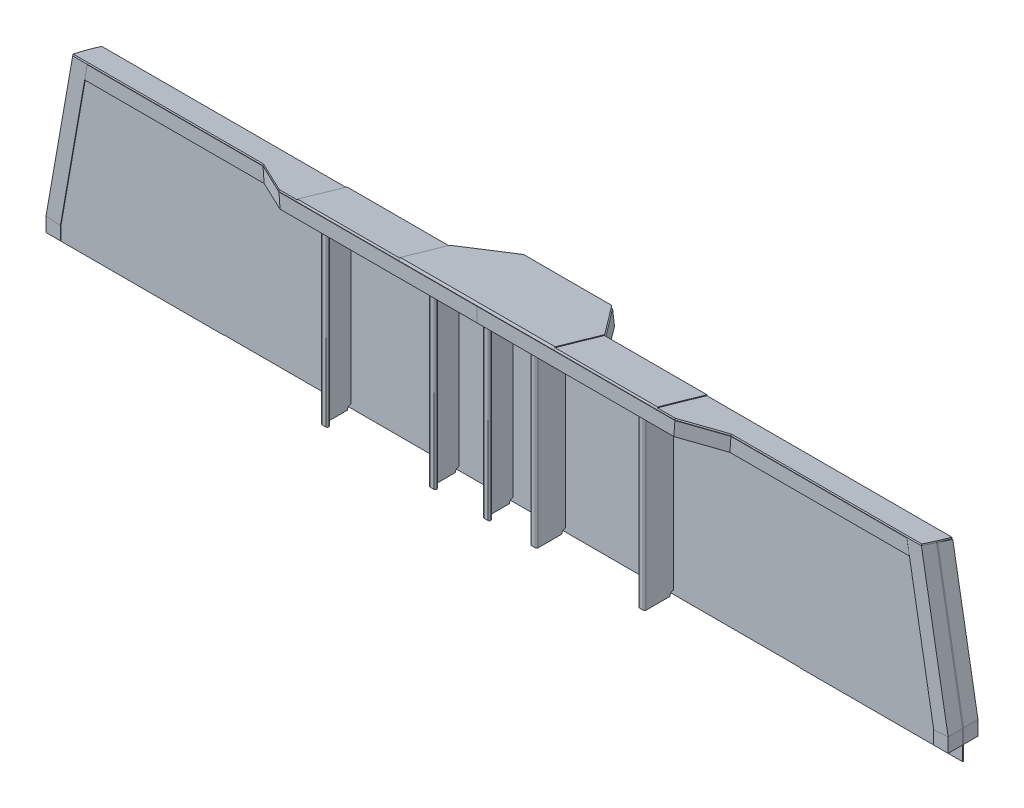
from build123d import *

# Parameters (mm, degrees)
EXTRUDE_1_DEPTH              = 3
EXTRUDE_2_DEPTH              = 8
EXTRUDE_3_DEPTH              = 6
SKETCH_7_W                   = 143.0000000000009
SKETCH_7_H                   = 680.999999999952
EXTRUDE_4_DEPTH              = 4
CUT_EXTRUDE_1_DEPTH          = 3887.794310978597
SWEEP_START                  = -3830
SWEEP_1_DEPTH                = 38
SWEEP_START_2                = -3793
SWEEP_1_2_DEPTH              = 1
SWEEP_START_3                = -921.503739553
SWEEP_1_3_DEPTH              = 416.27394826
SWEEP_START_4                = -505.316929463
SWEEP_1_4_DEPTH              = 3.846932143
SWEEP_START_5                = 693
SWEEP_1_5_DEPTH              = 40
EXTRUDE_5_REACH              = 4241.638
CUT_EXTRUDE_2_DEPTH          = 3887.350957917266
EXTRUDE_6_REACH              = 4215.277
PATTERN_LINEAR_1_COUNT       = 2
PATTERN_LINEAR_1_PITCH       = 150
PATTERN_LINEAR_2_COUNT       = 2
PATTERN_LINEAR_2_PITCH       = 450
EXTRUDE_7_DEPTH              = 4
EXTRUDE_8_REACH              = 4215.402
SKETCH_18_W                  = 20
SKETCH_18_H                  = 1
SKETCH_18_W_2                = 16.999999999999773
SKETCH_18_H_2                = 3.8854169092151096
CUT_EXTRUDE_3_DEPTH          = 1726.334637879581
CUT_EXTRUDE_4_DEPTH          = 4
EXTRUDE_9_DEPTH              = 3
CUT_EXTRUDE_5_DEPTH          = 3
EXTRUDE_10_DEPTH             = 3
FILLET_1_R                   = 8
FILLET_2_R                   = 11
PATTERN_LINEAR_3_COUNT       = 2
PATTERN_LINEAR_3_PITCH       = 150
CUT_EXTRUDE_6_DEPTH          = 4390.143704412877
PATTERN_START                = -3865
PATTERN_LINEAR_5_DEPTH       = 4
PATTERN_START_2              = 654
PATTERN_LINEAR_5_2_DEPTH     = 488.713254614
PATTERN_LINEAR_5_3_DEPTH     = 489
PATTERN_START_3              = 2155.791378016
PATTERN_LINEAR_5_4_OUTLINE_W = 6
PATTERN_LINEAR_5_4_OUTLINE_H = 34
PATTERN_LINEAR_5_4_DEPTH     = 9.208621984
CUT_EXTRUDE_7_DEPTH          = 4390.143704412877
SWEEP_START_6                = -3875
SWEEP_3_DEPTH                = 38
SWEEP_3_2_DEPTH              = 1
SWEEP_3_3_DEPTH              = 416.27394826
SWEEP_3_4_DEPTH              = 3.846932143
SWEEP_3_5_DEPTH              = 40
CUT_EXTRUDE_9_DEPTH          = 17
CUT_EXTRUDE_9_DEPTH_BACK     = 2563.0947984233594
SKETCH_34_W                  = 3.0000000000004547
SKETCH_34_H                  = 40
EXTRUDE_11_DEPTH             = 3
CUT_EXTRUDE_10_DEPTH         = 4345.251787695612
CUT_EXTRUDE_10_DEPTH_BACK    = 4345.251787695612
CUT_EXTRUDE_START            = -2001
CUT_EXTRUDE_11_DEPTH         = 5
CUT_EXTRUDE_START_2          = -4
CUT_EXTRUDE_11_2_DEPTH       = 5
CUT_EXTRUDE_START_3          = -1501
CUT_EXTRUDE_12_DEPTH         = 5
CUT_EXTRUDE_START_4          = -1201
CUT_EXTRUDE_12_2_DEPTH       = 5
CUT_EXTRUDE_START_5          = -304
CUT_EXTRUDE_12_3_DEPTH       = 5
CUT_EXTRUDE_12_4_DEPTH       = 5


with BuildPart() as part:
    # Эскиз3 → Бобышка-Вытянуть1 (new body)
    with BuildSketch(Plane.XY.offset(-3834.9999999999995)):
        Polygon((1253, 653), (1253, 733), (1181, 1143), (-1181, 1143), (-1253, 733), (-1253, 653), (-800, 653), (-800, 654.0000000000001), (800, 654.0000000000001), (800, 653), align=None)
    extrude(amount=EXTRUDE_1_DEPTH)


with BuildPart() as body_2:
    # Эскиз5 → Бобышка-Вытянуть2 (new body)
    with BuildSketch(Plane(origin=(0, 2072.279676120572, -594.2166351293336), x_dir=(0, -0.2756373558170004, -0.9612616959383186), z_dir=(0, -0.9612616959383186, 0.2756373558170004))):
        Polygon((3411.501321136804, -215.00000000000009), (3268.501321136804, -215.00000000000003), (3268.501321136804, 215.00000000000003), (3411.501321136804, 215.00000000000009), (3528.501321136804, 122.5), (3528.501321136804, -122.5), align=None)
    extrude(amount=-EXTRUDE_2_DEPTH)


with BuildPart() as body_3:
    # Эскиз6 → Бобышка-Вытянуть3 (new body)
    with BuildSketch(Plane(origin=(0, 2072.279676120572, -594.2166351293336), x_dir=(0, -0.2756373558170004, -0.9612616959383186), z_dir=(0, -0.9612616959383186, 0.2756373558170004))):
        Polygon((3268.5013211368023, 215.00000000000003), (3411.5013211368027, 215.00000000000009), (3411.501321136803, 500.000000000048), (3268.5013211368023, 500.000000000048), align=None)
    extrude(amount=-EXTRUDE_3_DEPTH)


with BuildPart() as body_4:
    # Эскиз7 → Бобышка-Вытянуть4 (new body)
    with BuildSketch(Plane(origin=(0, 2072.279676120572, -594.2166351293336), x_dir=(0, -0.2756373558170004, -0.9612616959383186), z_dir=(0, -0.9612616959383186, 0.2756373558170004))):
        with Locations((3340.001321136801, 840.500000000024)):
            Rectangle(SKETCH_7_W, SKETCH_7_H)
    extrude(amount=-EXTRUDE_4_DEPTH)

    # Эскиз10 → Вырез-Вытянуть1 (cut, through all)
    with BuildSketch(Plane(origin=(0, 2076.1247229043233, -595.3191845525989), x_dir=(1, 0, 0), z_dir=(0, 0.9612616959383188, -0.2756373558169998))):
        Polygon((550.000000000048, 3268.501321136802), (650.000000000048, 3326.501321136804), (1181, 3326.501321136804), (1181, 3268.501321136802), align=None)
    extrude(amount=-CUT_EXTRUDE_1_DEPTH, mode=Mode.SUBTRACT)


with BuildPart() as body_5:
    # По траектории1: read off the stored shape, not the designer's step
    # По траектории1 outline → По траектории1 (new body)
    with BuildSketch(Plane.XY.offset(SWEEP_START)):
        Polygon((1181, 1143), (1178.045215044, 1142.481110935), (1250, 732.738585489), (1250, 693), (1253, 693), (1253, 733), align=None)
    extrude(amount=SWEEP_1_DEPTH)

    # Sweep 1 2 outline → Sweep 1 2 (add)
    with BuildSketch(Plane.XY.offset(SWEEP_START_2)):
        Polygon((1141.60286725, 1136.081479127), (1213, 729.514473189), (1213, 693), (1250, 693), (1250, 732.738585489), (1178.045215044, 1142.481110935), align=None)
    extrude(amount=SWEEP_1_2_DEPTH)

    # Sweep 1 3 outline → Sweep 1 3 (add)
    with BuildSketch(Plane(origin=(0, 0, 0), x_dir=(0.9849283187519632, 0.17296302182961304, 0), z_dir=(0.17296302182961304, -0.9849283187519632, 0)).offset(SWEEP_START_3)):
        with BuildLine():
            Line((1360.897078397, -3830), (1357.897078397, -3830))
            ThreePointArc((1357.897078397, -3830), (1358.482864835, -3831.414213562), (1359.897078397, -3832))
            Line((1359.897078397, -3832), (1360.897078397, -3832))
            Line((1360.897078397, -3832), (1360.897078397, -3830))
        make_face()
        with BuildLine():
            ThreePointArc((1320.897078397, -3793), (1321.482864835, -3794.414213562), (1322.897078397, -3795))
            Line((1322.897078397, -3795), (1354.897078397, -3795))
            ThreePointArc((1354.897078397, -3795), (1357.018398741, -3795.878679656), (1357.897078397, -3798))
            Line((1357.897078397, -3798), (1357.897078398, -3793))
            Line((1357.897078398, -3793), (1320.897078397, -3793))
        make_face()
    extrude(amount=SWEEP_1_3_DEPTH)

    # Sweep 1 4 outline → Sweep 1 4 (add)
    with BuildSketch(Plane(origin=(0, 0, 0), x_dir=(0.9849283187519632, 0.17296302182961304, 0), z_dir=(0.17296302182961304, -0.9849283187519632, 0)).offset(SWEEP_START_4)):
        with BuildLine():
            ThreePointArc((1320.897078397, -3793), (1321.482864835, -3794.414213562), (1322.897078397, -3795))
            Line((1322.897078397, -3795), (1354.897078397, -3795))
            ThreePointArc((1354.897078397, -3795), (1357.018398741, -3795.878679656), (1357.897078397, -3798))
            Line((1357.897078397, -3798), (1357.897078398, -3793))
            Line((1357.897078398, -3793), (1320.897078397, -3793))
        make_face()
    extrude(amount=SWEEP_1_4_DEPTH)

    # Sweep 1 5 outline → Sweep 1 5 (add)
    with BuildSketch(Plane(origin=(0, 0, 0), x_dir=(1, 0, 0), z_dir=(0, 1, 0)).offset(SWEEP_START_5)):
        with BuildLine():
            ThreePointArc((1250, 3798), (1249.121320344, 3795.878679656), (1247, 3795))
            Line((1247, 3795), (1215, 3795))
            ThreePointArc((1215, 3795), (1213.585786438, 3794.414213562), (1213, 3793))
            Line((1213, 3793), (1250, 3793))
            Line((1250, 3793), (1250, 3798))
        make_face()
        with BuildLine():
            ThreePointArc((1252, 3832), (1250.585786438, 3831.414213562), (1250, 3830))
            Line((1250, 3830), (1253, 3830))
            Line((1253, 3830), (1253, 3832))
            Line((1253, 3832), (1252, 3832))
        make_face()
    extrude(amount=SWEEP_1_5_DEPTH)


    # Бобышка-Вытянуть5: up to this face of the body (flat: up to its plane)
    extrude_5_end = Plane(body_4.part.faces().sort_by_distance((814.422692418, 1145.330606227, -3826.87221018))[0])
    # Эскиз12 → Бобышка-Вытянуть5 (add, up to the picked face)
    with BuildSketch(Plane(origin=(-159.38607142032706, 907.6151289213092, 0), x_dir=(0.9849283187519633, 0.17296302182961268, 0), z_dir=(-0.17296302182961268, 0.9849283187519633, 0)), mode=Mode.PRIVATE) as extrude_5_sk1:
        with BuildLine():
            Line((1320.8970783973152, 3792.999999999999), (1320.8970783973152, 3791.9999999999995))
            Line((1320.8970783973152, 3791.9999999999995), (1360.8970783973157, 3791.9999999999995))
            Line((1360.8970783973157, 3791.9999999999995), (1360.8970783973155, 3831.9999999999995))
            Line((1360.8970783973155, 3831.9999999999995), (1359.8970783973155, 3831.9999999999995))
            ThreePointArc((1359.8970783973155, 3831.9999999999995), (1358.4828648349421, 3831.4142135623724), (1357.8970783973152, 3829.999999999999))
            Line((1357.8970783973152, 3829.999999999999), (1357.8970783973157, 3797.999999999999))
            ThreePointArc((1357.8970783973157, 3797.999999999999), (1357.018398740875, 3795.8786796564395), (1354.8970783973155, 3794.999999999999))
            Line((1354.8970783973155, 3794.999999999999), (1322.8970783973155, 3794.9999999999995))
            ThreePointArc((1322.8970783973155, 3794.9999999999995), (1321.4828648349421, 3794.4142135623724), (1320.8970783973152, 3792.999999999999))
        make_face()
    extrude_5_tool1 = split(extrude(extrude_5_sk1.sketch, amount=EXTRUDE_5_REACH, mode=Mode.PRIVATE), bisect_by=extrude_5_end, keep=Keep.BOTH, mode=Mode.PRIVATE)
    add(extrude_5_tool1.solids().sort_by(Axis((1142.160027, 1136.179322, -3792.5), (-0.17296302182961268, 0.9849283187519633, 0)))[0])


with BuildPart() as body_4_1:
    add(body_4.part)

    # Эскиз13 → Вырез-Вытянуть2 (cut, through all)
    with BuildSketch(Plane(origin=(0, 2072.27967612057, -594.2166351293309), x_dir=(1, 0, 0), z_dir=(0, -0.9612616959383187, 0.27563735581699983))):
        Polygon((1178.8274179401756, -3326.501321136804), (1181, -3371.3851062246213), (1181, -3326.501321136804), align=None)
    extrude(amount=-CUT_EXTRUDE_2_DEPTH, mode=Mode.SUBTRACT)


with BuildPart() as body_6:
    # Бобышка-Вытянуть6: up to this plane
    extrude_6_end = Plane(origin=(0, 2072.2796761205745, -594.216635129336), z_dir=(0, -0.9612616959383185, 0.2756373558170011))
    # Эскиз14 → Бобышка-Вытянуть6 (new, up to the surface)
    with BuildSketch(Plane.XZ.offset(-654.0000000000001), mode=Mode.PRIVATE) as extrude_6_sk1:
        with BuildLine():
            Line((-6.6613e-13, -3831.9999999999995), (-1.22125e-12, -3755.9999999999995))
            ThreePointArc((-1.22125e-12, -3755.9999999999995), (1.1715728752524424, -3753.1715728752533), (3.9999999999985603, -3751.9999999999995))
            Line((3.9999999999985603, -3751.9999999999995), (14.289016615090855, -3751.999999999999))
            ThreePointArc((14.289016615090855, -3751.999999999999), (18.091689930528247, -3754.7591633241786), (16.64826487307003, -3759.2301621719685))
            Line((16.64826487307003, -3759.2301621719685), (5.640751742019723, -3767.2698378280297))
            ThreePointArc((5.640751742019723, -3767.2698378280297), (4.433699884198441, -3768.688507939834), (3.9999999999987823, -3770.499999999999))
            Line((3.9999999999987823, -3770.499999999999), (3.9999999999992264, -3831.999999999999))
            Line((3.9999999999992264, -3831.999999999999), (-6.6613e-13, -3831.9999999999995))
        make_face()
    extrude_6_tool1 = split(extrude(extrude_6_sk1.sketch, amount=-EXTRUDE_6_REACH, mode=Mode.PRIVATE), bisect_by=extrude_6_end, keep=Keep.BOTH, mode=Mode.PRIVATE)
    add(extrude_6_tool1.solids().sort_by_distance((3.179361, 654, -3801.25))[0])


with BuildPart() as body_7:
    # Зеркальное отражение1: mirrored copy
    add(body_3.part.mirror(Plane(origin=(0, 0, 0), x_dir=(0, 0, 1), z_dir=(1, 0, 0))))


with BuildPart() as body_8:
    # Mirror 1 2: mirrored copy
    add(body_4_1.part.mirror(Plane(origin=(0, 0, 0), x_dir=(0, 0, 1), z_dir=(1, 0, 0))))


with BuildPart() as body_9:
    # Mirror 1 3: mirrored copy
    add(body_5.part.mirror(Plane(origin=(0, 0, 0), x_dir=(0, 0, 1), z_dir=(1, 0, 0))))


with BuildPart() as pattern_linear_1_1:
    # Линейный массив1: pattern copy
    add(body_6.part.moved(Location(Vector(-1, 0, 0) * (1 * PATTERN_LINEAR_1_PITCH))))


with BuildPart() as pattern_linear_2_1:
    # Линейный массив2: pattern copy
    add(body_6.part.moved(Location(Vector(-1, 0, -1e-17) * (1 * PATTERN_LINEAR_2_PITCH))))


with BuildPart() as body_12:
    # По траектории2: sweep along a path in Эскиз15
    with BuildLine(Plane(origin=(0, 2072.2796761205745, -594.2166351293362), x_dir=(1, 0, 0), z_dir=(0, -0.9612616959383179, 0.2756373558170027))) as sweep_2_path:
        Line((0, -3268.5013211367946), (550.0000000000482, -3268.501321136796))
        Line((550.0000000000482, -3268.501321136796), (650.000000000048, -3326.501321136801))
        Line((650.000000000048, -3326.501321136801), (1138.1264851354745, -3326.5013211368))
    # Эскиз9 → По траектории2 (sweep)
    with BuildSketch(Plane(origin=(0, 0, 0), x_dir=(0, 0, -1), z_dir=(1, 0, 0))):
        Polygon((3736.101758261928, 1170.211632935017), (3736.101758261928, 1130.211632935017), (3740.1017582619274, 1130.211632935017), (3740.101758261928, 1170.211632935017), align=None)
    sweep(path=sweep_2_path.line, transition=Transition.RIGHT)

    # Эскиз16 → Бобышка-Вытянуть7 (add)
    with BuildSketch(Plane.XY.offset(-3791.854936626358)):
        Polygon((1138.1264851354676, 1154.22466629763), (1138.1264851354676, 1114.2246662976308), (1145.4411368199212, 1114.2246662976288), (1138.4167465760186, 1154.22466629763), align=None)
    extrude(amount=-EXTRUDE_7_DEPTH)


with BuildPart() as body_13:
    # Зеркальное отражение3: mirrored copy
    add(body_12.part.mirror(Plane(origin=(0, 0, 0), x_dir=(0, 0, 1), z_dir=(1, 0, 0))))


with BuildPart() as body_14:
    # Mirror 3 2: mirrored copy
    add(body_5.part.mirror(Plane(origin=(0, 0, 0), x_dir=(0, 0, 1), z_dir=(1, 0, 0))))


with BuildPart() as body_15:
    # Mirror 3 3: mirrored copy
    add(pattern_linear_1_1.part.mirror(Plane(origin=(0, 0, 0), x_dir=(0, 0, 1), z_dir=(1, 0, 0))))


with BuildPart() as body_16:
    # Mirror 3 4: mirrored copy
    add(pattern_linear_2_1.part.mirror(Plane(origin=(0, 0, 0), x_dir=(0, 0, 1), z_dir=(1, 0, 0))))


with BuildPart() as body_17:
    # Бобышка-Вытянуть8: up to this plane
    extrude_8_end = Plane(origin=(0, 2072.279676120572, -594.2166351293336), z_dir=(0, -0.9612616959383186, 0.2756373558170004))
    # Эскиз17 → Бобышка-Вытянуть8 (new, up to the surface)
    with BuildSketch(Plane.XZ.offset(-653), mode=Mode.PRIVATE) as extrude_8_sk1:
        with BuildLine():
            Line((749.9999999999991, -3835), (749.9999999999986, -3865))
            Line((749.9999999999986, -3865), (729.9999999999986, -3865))
            Line((729.9999999999986, -3865), (729.9999999999986, -3864))
            ThreePointArc((729.9999999999986, -3864), (730.2928932188123, -3863.292893218814), (730.9999999999985, -3863.0000000000005))
            Line((730.9999999999985, -3863.0000000000005), (744.9999999999983, -3863.0000000000005))
            ThreePointArc((744.9999999999983, -3863.0000000000005), (746.4142135623715, -3862.414213562373), (746.9999999999985, -3861))
            Line((746.9999999999985, -3861), (746.999999999999, -3836.0000000000005))
            ThreePointArc((746.999999999999, -3836.0000000000005), (747.2928932188124, -3835.292893218814), (747.9999999999989, -3835))
            Line((747.9999999999989, -3835), (749.9999999999991, -3835))
        make_face()
    extrude_8_tool1 = split(extrude(extrude_8_sk1.sketch, amount=-EXTRUDE_8_REACH, mode=Mode.PRIVATE), bisect_by=extrude_8_end, keep=Keep.BOTH, mode=Mode.PRIVATE)
    add(extrude_8_tool1.solids().sort_by_distance((749.639445, 653, -3850))[0])
    # Эскиз17 → Бобышка-Вытянуть8 (new, up to the surface)
    with BuildSketch(Plane.XZ.offset(-653), mode=Mode.PRIVATE) as extrude_8_sk2:
        with BuildLine():
            Line((999.9999999999993, -3835), (999.9999999999989, -3865))
            Line((999.9999999999989, -3865), (979.9999999999989, -3865))
            Line((979.9999999999989, -3865), (979.9999999999989, -3864))
            ThreePointArc((979.9999999999989, -3864), (980.2928932188125, -3863.292893218814), (980.9999999999987, -3863.0000000000005))
            Line((980.9999999999987, -3863.0000000000005), (994.9999999999985, -3863.0000000000005))
            ThreePointArc((994.9999999999985, -3863.0000000000005), (996.4142135623717, -3862.414213562373), (996.9999999999987, -3861))
            Line((996.9999999999987, -3861), (996.9999999999992, -3836.0000000000005))
            ThreePointArc((996.9999999999992, -3836.0000000000005), (997.2928932188127, -3835.292893218814), (997.9999999999991, -3835))
            Line((997.9999999999991, -3835), (999.9999999999993, -3835))
        make_face()
    extrude_8_tool2 = split(extrude(extrude_8_sk2.sketch, amount=-EXTRUDE_8_REACH, mode=Mode.PRIVATE), bisect_by=extrude_8_end, keep=Keep.BOTH, mode=Mode.PRIVATE)
    add(extrude_8_tool2.solids().sort_by_distance((999.639445, 653, -3850))[0])

    # Эскиз18 → Вырез-Вытянуть3 (cut, through all)
    with BuildSketch(Plane(origin=(0, 0, -3865), x_dir=(-1, 0, 0), z_dir=(0, 0, -1))):
        with Locations((-739.9999999999986, 653.4999999999835)):
            Rectangle(SKETCH_18_W, SKETCH_18_H)
        Polygon((-979.9999999999989, 1134.3976384272362), (-996.9999999999987, 1134.3976384272362), (-979.9999999999989, 1099.3976384272364), align=None)
        with Locations((-988.4999999999989, 1136.3403468818437)):
            Rectangle(SKETCH_18_W_2, SKETCH_18_H_2)
        Polygon((-746.9999999999986, 1134.3976384272362), (-729.9999999999986, 1099.3976384272364), (-729.9999999999986, 1134.3976384272362), (-729.9999999999986, 1141.8733589244994), (-746.9999999999986, 1141.8733589244994), align=None)
    extrude(amount=-CUT_EXTRUDE_3_DEPTH, mode=Mode.SUBTRACT)

    # Эскиз19 → Вырез-Вытянуть4 (cut)
    with BuildSketch(Plane(origin=(0, 0, -3865), x_dir=(-1, 0, 0), z_dir=(0, 0, -1))):
        Polygon((-996.9999999999987, 653), (-979.9999999999989, 688), (-979.9999999999989, 653), align=None)
        Polygon((-746.9999999999986, 653.9999999999835), (-729.9999999999986, 688.9999999999835), (-729.9999999999986, 653.9999999999835), align=None)
    extrude(amount=-CUT_EXTRUDE_4_DEPTH, mode=Mode.SUBTRACT)


with BuildPart() as body_18:
    # Эскиз20 → Бобышка-Вытянуть9 (new body)
    with BuildSketch(Plane(origin=(0, 0, 0), x_dir=(0, 0, -1), z_dir=(1, 0, 0))):
        Polygon((3844.6126169593826, 1140.2436264418304), (3954.9999999999995, 1108.5905537089436), (3874.9999999999995, 653), (3844.999999999999, 653), (3834.9999999999995, 663), (3834.9999999999995, 1133), align=None)
    extrude(amount=EXTRUDE_9_DEPTH)

    # Эскиз22 → Вырез-Вытянуть5 (cut)
    with BuildSketch(Plane(origin=(3, 0, 0), x_dir=(0, 0, -1), z_dir=(1, 0, 0))):
        Polygon((3866.877600163144, 653), (3874.0385606377054, 693.7808243461635), (3881.9180052951324, 692.3972232871369), (3874.9999999999995, 653), align=None)
        Polygon((3954.9999999999995, 1108.5905537089436), (3948.0819947048667, 1069.1933304218066), (3940.2025500474397, 1070.576931480833), (3947.266969235292, 1110.8079645986545), align=None)
    extrude(amount=-CUT_EXTRUDE_5_DEPTH, mode=Mode.SUBTRACT)

    # Эскиз23 → Бобышка-Вытянуть10 (add)
    with BuildSketch(Plane(origin=(0, -640.5501423302909, -3647.8574252824947), x_dir=(-1, 0, 0), z_dir=(0, -0.17295013237831955, -0.9849305821784202))):
        Polygon((0, 1735.9025130183006), (0, 1353.3414331284964), (-9.99999999999995, 1353.3414331284964), (-29.999999999999957, 1383.3414331284966), (-30.000000000000036, 1705.9025130183006), (-10.000000000000044, 1735.9025130183006), align=None)
    extrude(amount=EXTRUDE_10_DEPTH)

    # Скругление1
    fillet_1_edges = [body_18.edges().sort_by_distance(p)[0] for p in [
        (3, 880.7952768544717, -3914.9999999999995),
    ]]
    fillet(fillet_1_edges, radius=FILLET_1_R)

    # Скругление2
    fillet_2_edges = [body_18.edges().sort_by_distance(p)[0] for p in [
        (0, 880.2764264573366, -3917.954791746535),
    ]]
    fillet(fillet_2_edges, radius=FILLET_2_R)


with BuildPart() as pattern_linear_3_1:
    # Линейный массив3: pattern copy
    add(body_18.part.moved(Location(Vector(-1, 3e-17, 0) * (1 * PATTERN_LINEAR_3_PITCH))))

    # Эскиз24 → Вырез-Вытянуть6 (cut, through all)
    with BuildSketch(Plane.ZY.offset(150)):
        Polygon((-3937.600680779407, 1113.5797282107933), (-3940.202550047439, 1070.5769314808333), (-3947.266969235292, 1110.8079645986545), align=None)
    extrude(amount=-CUT_EXTRUDE_6_DEPTH, mode=Mode.SUBTRACT)


with BuildPart() as body_20:
    # Линейный массив5: read off the stored shape, not the designer's step
    # Линейный массив5 outline → Линейный массив5 (new body)
    with BuildSketch(Plane.XY.offset(PATTERN_START)):
        Polygon((447, 1134.397638427), (430, 1099.397638427), (430, 689), (447, 654), align=None)
    extrude(amount=PATTERN_LINEAR_5_DEPTH)

    # Pattern Linear 5 2 outline → Pattern Linear 5 2 (cut)
    with BuildSketch(Plane(origin=(0, 0, 0), x_dir=(1, 0, 0), z_dir=(0, 1, 0)).offset(PATTERN_START_2)):
        with BuildLine():
            Line((430, 3861), (447, 3861))
            ThreePointArc((447, 3861), (446.414213562, 3862.414213562), (445, 3863))
            Line((445, 3863), (431, 3863))
            ThreePointArc((431, 3863), (430.292893219, 3863.292893219), (430, 3864))
            Line((430, 3864), (430, 3861))
        make_face()
    extrude(amount=PATTERN_LINEAR_5_2_DEPTH, mode=Mode.SUBTRACT)

    # Pattern Linear 5 3 outline → Pattern Linear 5 3 (add)
    with BuildSketch(Plane(origin=(0, 0, 0), x_dir=(1, 0, 0), z_dir=(0, 1, 0)).offset(PATTERN_START_2)):
        with BuildLine():
            ThreePointArc((447, 3836), (447.292893219, 3835.292893219), (448, 3835))
            Line((448, 3835), (450, 3835))
            Line((450, 3835), (450, 3865))
            Line((450, 3865), (447, 3865))
            Line((447, 3865), (447, 3836))
        make_face()
    extrude(amount=PATTERN_LINEAR_5_3_DEPTH)

    # Pattern Linear 5 4 outline → Pattern Linear 5 4 (cut)
    with BuildSketch(Plane(origin=(0, 0, 0), x_dir=(1, 0, 0), z_dir=(0, 0.9612616959383188, -0.27563735581699994)).offset(PATTERN_START_3)):
        with Locations((448.00000000000006, 3387.0000000000005)):
            Rectangle(PATTERN_LINEAR_5_4_OUTLINE_W, PATTERN_LINEAR_5_4_OUTLINE_H)
    extrude(amount=PATTERN_LINEAR_5_4_DEPTH, mode=Mode.SUBTRACT)


with BuildPart() as body_21:
    # Зеркальное отражение4: mirrored copy
    add(pattern_linear_3_1.part.mirror(Plane(origin=(0, 0, 0), x_dir=(0, 0, 1), z_dir=(1, 0, 0))))


with BuildPart() as body_22:
    # Mirror 4 2: mirrored copy
    add(body_20.part.mirror(Plane(origin=(0, 0, 0), x_dir=(0, 0, 1), z_dir=(1, 0, 0))))


with BuildPart() as body_23:
    # Mirror 4 3: mirrored copy
    add(body_17.part.mirror(Plane(origin=(0, 0, 0), x_dir=(0, 0, 1), z_dir=(1, 0, 0))))


with BuildPart() as cut_extrude_7_tool:
    # Эскиз25 → Вырез-Вытянуть7 (new, through all)
    with BuildSketch(Plane.ZY.offset(150)):
        Polygon((-3866.8776001631436, 653), (-3844.999999999999, 653), (-3843.9999999999995, 654), (-3867.0531964290208, 654), align=None)
    extrude(amount=-CUT_EXTRUDE_7_DEPTH)


with BuildPart() as body_18_1:
    add(body_18.part)

    # Вырез-Вытянуть7: cut by cut_extrude_7_tool
    add(cut_extrude_7_tool.part, mode=Mode.SUBTRACT)


with BuildPart() as pattern_linear_3_1_1:
    add(pattern_linear_3_1.part)

    # Вырез-Вытянуть7: cut by cut_extrude_7_tool
    add(cut_extrude_7_tool.part, mode=Mode.SUBTRACT)


with BuildPart() as body_21_1:
    add(body_21.part)

    # Вырез-Вытянуть7: cut by cut_extrude_7_tool
    add(cut_extrude_7_tool.part, mode=Mode.SUBTRACT)


with BuildPart() as body_24:
    # По траектории3: read off the stored shape, not the designer's step
    # По траектории3 outline → По траектории3 (new body)
    with BuildSketch(Plane.XY.offset(SWEEP_START_6)):
        Polygon((1178.045215044, 1142.481110935), (1250, 732.738585489), (1250, 693), (1253, 693), (1253, 733), (1181, 1143), align=None)
    extrude(amount=SWEEP_3_DEPTH)

    # Sweep 3 2 outline → Sweep 3 2 (add)
    with BuildSketch(Plane.XY.offset(SWEEP_START_6)):
        Polygon((1250, 693), (1250, 732.738585489), (1178.045215044, 1142.481110935), (1141.60286725, 1136.081479127), (1213, 729.514473189), (1213, 693), align=None)
    extrude(amount=SWEEP_3_2_DEPTH)

    # Sweep 3 3 outline → Sweep 3 3 (add)
    with BuildSketch(Plane(origin=(0, 0, 0), x_dir=(0.9849283187519632, 0.17296302182961304, 0), z_dir=(0.17296302182961304, -0.9849283187519632, 0)).offset(SWEEP_START_3)):
        with BuildLine():
            Line((1357.897078398, -3874), (1357.897078397, -3869))
            ThreePointArc((1357.897078397, -3869), (1357.018398741, -3871.121320344), (1354.897078397, -3872))
            Line((1354.897078397, -3872), (1322.897078397, -3872))
            ThreePointArc((1322.897078397, -3872), (1321.482864835, -3872.585786438), (1320.897078397, -3874))
            Line((1320.897078397, -3874), (1357.897078398, -3874))
        make_face()
        with BuildLine():
            Line((1360.897078397, -3835), (1359.897078397, -3835))
            ThreePointArc((1359.897078397, -3835), (1358.482864835, -3835.585786438), (1357.897078397, -3837))
            Line((1357.897078397, -3837), (1360.897078397, -3837))
            Line((1360.897078397, -3837), (1360.897078397, -3835))
        make_face()
    extrude(amount=SWEEP_3_3_DEPTH)

    # Sweep 3 4 outline → Sweep 3 4 (add)
    with BuildSketch(Plane(origin=(0, 0, 0), x_dir=(0.9849283187519632, 0.17296302182961304, 0), z_dir=(0.17296302182961304, -0.9849283187519632, 0)).offset(SWEEP_START_4)):
        with BuildLine():
            Line((1357.897078398, -3874), (1357.897078397, -3869))
            ThreePointArc((1357.897078397, -3869), (1357.018398741, -3871.121320344), (1354.897078397, -3872))
            Line((1354.897078397, -3872), (1322.897078397, -3872))
            ThreePointArc((1322.897078397, -3872), (1321.482864835, -3872.585786438), (1320.897078397, -3874))
            Line((1320.897078397, -3874), (1357.897078398, -3874))
        make_face()
    extrude(amount=SWEEP_3_4_DEPTH)

    # Sweep 3 5 outline → Sweep 3 5 (add)
    with BuildSketch(Plane(origin=(0, 0, 0), x_dir=(1, 0, 0), z_dir=(0, 1, 0)).offset(SWEEP_START_5)):
        with BuildLine():
            ThreePointArc((1250, 3837), (1250.585786438, 3835.585786438), (1252, 3835))
            Line((1252, 3835), (1253, 3835))
            Line((1253, 3835), (1253, 3837))
            Line((1253, 3837), (1250, 3837))
        make_face()
        with BuildLine():
            ThreePointArc((1247, 3872), (1249.121320344, 3871.121320344), (1250, 3869))
            Line((1250, 3869), (1250, 3874))
            Line((1250, 3874), (1213, 3874))
            ThreePointArc((1213, 3874), (1213.585786438, 3872.585786438), (1215, 3872))
            Line((1215, 3872), (1247, 3872))
        make_face()
    extrude(amount=SWEEP_3_5_DEPTH)

    # Эскиз32 → Вырез-Вытянуть9 (cut, two sides: drawn at the far end of the back side and taken through both)
    with BuildSketch(Plane(origin=(0, -940.3372035243515, -3279.3455456517763), x_dir=(-1, 0, 0), z_dir=(0, -0.2756373558170004, -0.9612616959383186)).offset(-CUT_EXTRUDE_9_DEPTH_BACK)):
        Polygon((-1125.4733485441068, 2155.7913780156946), (-1187.824311188497, 2155.7913780156946), (-1187.2113101512628, 2170.4115432545163), (-1135.193793563106, 2173.388976863947), align=None)
    extrude(amount=CUT_EXTRUDE_9_DEPTH + CUT_EXTRUDE_9_DEPTH_BACK, mode=Mode.SUBTRACT)


with BuildPart() as body_25:
    # По траектории5: sweep along a path in Эскиз36
    with BuildLine(Plane(origin=(0, 2072.2796761205755, -594.2166351293364), x_dir=(1, 0, 0), z_dir=(0, -0.9612616959383183, 0.27563735581700116))) as sweep_5_path:
        Line((0, -3528.501321136802), (122.5, -3528.501321136802))
        Line((122.5, -3528.501321136802), (215.00000000000009, -3411.501321136802))
        Line((215.00000000000009, -3411.501321136802), (1142.1586147111782, -3411.501321136799))
    # Эскиз34 → По траектории5 (sweep)
    with BuildSketch(Plane(origin=(0, 0, 0), x_dir=(0, 0, -1), z_dir=(1, 0, 0))):
        with Locations((3987.529799205895, 1079.6929019656309)):
            Rectangle(SKETCH_34_W, SKETCH_34_H)
    sweep(path=sweep_5_path.line, transition=Transition.RIGHT)

    # Эскиз37 → Бобышка-Вытянуть11 (add)
    with BuildSketch(Plane(origin=(1.114074e-11, -2.736e-13, -3876.562180781112), x_dir=(-1, 0, -2.87e-15), z_dir=(2.87e-15, -7e-17, -1))):
        Polygon((-1142.158614711167, 1131.9424725962213), (-1142.158614711167, 1091.9424725962213), (-1149.1830049550695, 1091.9424725962213), align=None)
    extrude(amount=-EXTRUDE_11_DEPTH)


with BuildPart() as body_26:
    # Зеркальное отражение5: mirrored copy
    add(body_25.part.mirror(Plane(origin=(0, 0, 0), x_dir=(0, 0, 1), z_dir=(1, 0, 0))))


with BuildPart() as body_27:
    # Mirror 5 2: mirrored copy
    add(body_24.part.mirror(Plane(origin=(0, 0, 0), x_dir=(0, 0, 1), z_dir=(1, 0, 0))))


with BuildPart() as cut_extrude_10_tool:
    # Эскиз38 → Вырез-Вытянуть10 (new, two sides: drawn at the far end of the back side and taken through both)
    with BuildSketch(Plane(origin=(0, 0, 0), x_dir=(0, 0, -1), z_dir=(1, 0, 0)).offset(-CUT_EXTRUDE_10_DEPTH_BACK)):
        with BuildLine():
            Line((3831.999999999999, 1133.8602361572782), (3831.999999999999, 1143.8602361572782))
            Line((3831.999999999999, 1143.8602361572782), (3822.3873830406155, 1146.6166097154476))
            ThreePointArc((3822.3873830406155, 1146.6166097154476), (3824.0136448995263, 1137.8420859257574), (3831.999999999999, 1133.8602361572782))
        make_face()
        with BuildLine():
            Line((3835.0000000000014, 1136), (3835.0000000000014, 1142.9999999999998))
            Line((3835.0000000000014, 1142.9999999999998), (3841.7288318715696, 1141.0705385092813))
            ThreePointArc((3841.7288318715696, 1141.0705385092813), (3839.212705162066, 1137.4095514296691), (3835.0000000000014, 1136))
        make_face()
        with BuildLine():
            Line((3831.999999999999, 664.0000000000002), (3831.999999999999, 654.0000000000002))
            Line((3831.999999999999, 654.0000000000002), (3821.999999999999, 654.0000000000002))
            ThreePointArc((3821.999999999999, 654.0000000000002), (3824.928932188134, 661.0710678118658), (3831.999999999999, 664.0000000000002))
        make_face()
    extrude(amount=CUT_EXTRUDE_10_DEPTH + CUT_EXTRUDE_10_DEPTH_BACK)


with BuildPart() as body_6_1:
    add(body_6.part)

    # Вырез-Вытянуть10: cut by cut_extrude_10_tool
    add(cut_extrude_10_tool.part, mode=Mode.SUBTRACT)


with BuildPart() as pattern_linear_1_1_1:
    add(pattern_linear_1_1.part)

    # Вырез-Вытянуть10: cut by cut_extrude_10_tool
    add(cut_extrude_10_tool.part, mode=Mode.SUBTRACT)


with BuildPart() as pattern_linear_2_1_1:
    add(pattern_linear_2_1.part)

    # Вырез-Вытянуть10: cut by cut_extrude_10_tool
    add(cut_extrude_10_tool.part, mode=Mode.SUBTRACT)


with BuildPart() as body_15_1:
    add(body_15.part)

    # Вырез-Вытянуть10: cut by cut_extrude_10_tool
    add(cut_extrude_10_tool.part, mode=Mode.SUBTRACT)


with BuildPart() as body_16_1:
    add(body_16.part)

    # Вырез-Вытянуть10: cut by cut_extrude_10_tool
    add(cut_extrude_10_tool.part, mode=Mode.SUBTRACT)


with BuildPart() as body_17_1:
    add(body_17.part)

    # Вырез-Вытянуть10: cut by cut_extrude_10_tool
    add(cut_extrude_10_tool.part, mode=Mode.SUBTRACT)

    # Cut-Extrude 11 2 outline → Cut-Extrude 11 2 (cut)
    with BuildSketch(Plane(origin=(1000.0000000000562, 0, -1.480297e-11), x_dir=(-1.48e-14, 0, -1), z_dir=(1, 0, -1.48e-14)).offset(CUT_EXTRUDE_START_2)):
        with BuildLine():
            Line((3835, 653), (3842, 653))
            ThreePointArc((3842, 653), (3839.949747468, 657.949747468), (3835, 660))
            Line((3835, 660), (3835, 653))
        make_face()
    extrude(amount=CUT_EXTRUDE_11_2_DEPTH, mode=Mode.SUBTRACT)

    # Cut-Extrude 12 4 outline → Cut-Extrude 12 4 (cut)
    with BuildSketch(Plane(origin=(750.0000000000558, 0, -1.110223e-11), x_dir=(-1.48e-14, 0, -1), z_dir=(1, 0, -1.48e-14)).offset(CUT_EXTRUDE_START_2)):
        with BuildLine():
            Line((3835, 654), (3842, 654))
            ThreePointArc((3842, 654), (3839.949747468, 658.949747468), (3835, 661))
            Line((3835, 661), (3835, 654))
        make_face()
    extrude(amount=CUT_EXTRUDE_12_4_DEPTH, mode=Mode.SUBTRACT)


with BuildPart() as body_20_1:
    add(body_20.part)

    # Вырез-Вытянуть10: cut by cut_extrude_10_tool
    add(cut_extrude_10_tool.part, mode=Mode.SUBTRACT)

    # Cut-Extrude 12 3 outline → Cut-Extrude 12 3 (cut)
    with BuildSketch(Plane(origin=(750.0000000000558, 0, -1.110223e-11), x_dir=(-1.48e-14, 0, -1), z_dir=(1, 0, -1.48e-14)).offset(CUT_EXTRUDE_START_5)):
        with BuildLine():
            Line((3835, 654), (3842, 654))
            ThreePointArc((3842, 654), (3839.949747468, 658.949747468), (3835, 661))
            Line((3835, 661), (3835, 654))
        make_face()
    extrude(amount=CUT_EXTRUDE_12_3_DEPTH, mode=Mode.SUBTRACT)


with BuildPart() as body_22_1:
    add(body_22.part)

    # Вырез-Вытянуть10: cut by cut_extrude_10_tool
    add(cut_extrude_10_tool.part, mode=Mode.SUBTRACT)

    # Cut-Extrude 12 2 outline → Cut-Extrude 12 2 (cut)
    with BuildSketch(Plane(origin=(750.0000000000558, 0, -1.110223e-11), x_dir=(-1.48e-14, 0, -1), z_dir=(1, 0, -1.48e-14)).offset(CUT_EXTRUDE_START_4)):
        with BuildLine():
            Line((3835, 654), (3842, 654))
            ThreePointArc((3842, 654), (3839.949746821, 658.949748116), (3834.999998169, 661))
            Line((3834.999998169, 661), (3835, 654))
        make_face()
    extrude(amount=CUT_EXTRUDE_12_2_DEPTH, mode=Mode.SUBTRACT)


with BuildPart() as body_23_1:
    add(body_23.part)

    # Вырез-Вытянуть10: cut by cut_extrude_10_tool
    add(cut_extrude_10_tool.part, mode=Mode.SUBTRACT)

    # Вырез-Вытянуть11: read off the stored shape, not the designer's step
    # Вырез-Вытянуть11 outline → Вырез-Вытянуть11 (cut)
    with BuildSketch(Plane(origin=(1000.0000000000562, 0, -1.480297e-11), x_dir=(-1.48e-14, 0, -1), z_dir=(1, 0, -1.48e-14)).offset(CUT_EXTRUDE_START)):
        with BuildLine():
            Line((3835, 653), (3842, 653))
            ThreePointArc((3842, 653), (3839.949746821, 657.949748116), (3834.999998169, 660))
            Line((3834.999998169, 660), (3835, 653))
        make_face()
    extrude(amount=CUT_EXTRUDE_11_DEPTH, mode=Mode.SUBTRACT)

    # Вырез-Вытянуть12: read off the stored shape, not the designer's step
    # Вырез-Вытянуть12 outline → Вырез-Вытянуть12 (cut)
    with BuildSketch(Plane(origin=(750.0000000000558, 0, -1.110223e-11), x_dir=(-1.48e-14, 0, -1), z_dir=(1, 0, -1.48e-14)).offset(CUT_EXTRUDE_START_3)):
        with BuildLine():
            Line((3835, 654), (3842, 654))
            ThreePointArc((3842, 654), (3839.949746821, 658.949748116), (3834.999998169, 661))
            Line((3834.999998169, 661), (3835, 654))
        make_face()
    extrude(amount=CUT_EXTRUDE_12_DEPTH, mode=Mode.SUBTRACT)


solid = Compound([part.part, body_2.part, body_3.part, body_5.part, body_4_1.part, body_7.part, body_8.part, body_9.part, body_12.part, body_13.part, body_14.part, body_18_1.part, pattern_linear_3_1_1.part, body_21_1.part, body_24.part, body_25.part, body_26.part, body_27.part, body_6_1.part, pattern_linear_1_1_1.part, pattern_linear_2_1_1.part, body_15_1.part, body_16_1.part, body_17_1.part, body_20_1.part, body_22_1.part, body_23_1.part])
